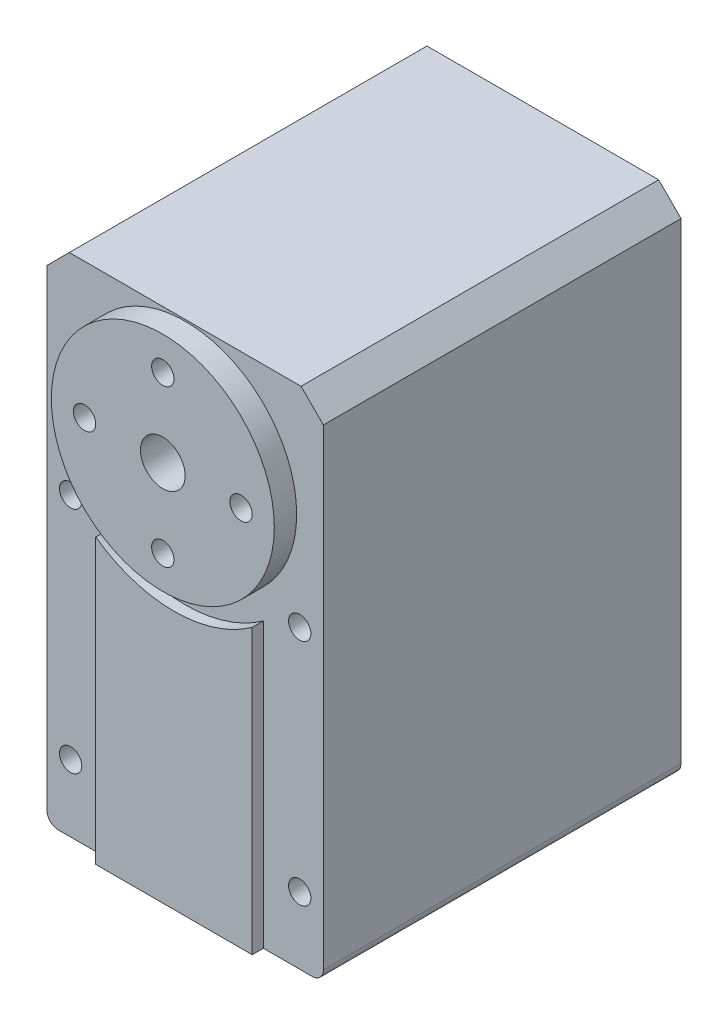
from build123d import *

# Parameters (mm, degrees)
SKETCH_1_W          = 24.73
SKETCH_1_H          = 45.23
EXTRUDE_1_DEPTH     = 32
CHAMFER_1_SIZE      = 2
EXTRUDE_2_DEPTH     = 1
SKETCH_3_R          = 1
CUT_EXTRUDE_1_DEPTH = 4
SKETCH_4_R          = 9.975
EXTRUDE_3_DEPTH     = 2
SKETCH_5_R          = 2
SKETCH_5_R_2        = 1
CUT_EXTRUDE_2_DEPTH = 3
SKETCH_6_W          = 20.33
SKETCH_6_H          = 12
EXTRUDE_4_DEPTH     = 2
CHAMFER_2_SIZE      = 2
SKETCH_7_W          = 22.33
SKETCH_7_H          = 5
CUT_EXTRUDE_3_DEPTH = 2
SKETCH_8_R          = 3
EXTRUDE_5_DEPTH     = 4.1
CUT_EXTRUDE_START   = -4
SKETCH_9_R          = 1
CUT_EXTRUDE_4_DEPTH = 4
FILLET_1_R          = 1


with BuildPart() as part:
    # 스케치1 → 보스-돌출1 (new body)
    with BuildSketch(Plane.XY):
        Rectangle(SKETCH_1_W, SKETCH_1_H)
    extrude(amount=EXTRUDE_1_DEPTH)

    # 모따기1
    chamfer_1_edges = [part.edges().sort_by_distance(p)[0] for p in [
        (-12.365, 22.615, 16),
        (12.365, 22.615, 16),
    ]]
    chamfer(chamfer_1_edges, length=CHAMFER_1_SIZE)

    # 스케치2 → 보스-돌출2 (add)
    with BuildSketch(Plane.XY.offset(32)):
        with BuildLine():
            Line((-7, -22.615), (7, -22.615))
            Line((7, -22.615), (7, 2.753205655))
            ThreePointArc((7, 2.753205655), (0, 0.5), (-7, 2.753205655))
            Line((-7, 2.753205655), (-7, -22.615))
        make_face()
    extrude(amount=EXTRUDE_2_DEPTH)

    # 스케치3 → 컷-돌출1 (cut)
    with BuildSketch(Plane.XY.offset(32)):
        with Locations((-10.25, 3.885)):
            Circle(SKETCH_3_R)
        with Locations((-10.25, -16.615)):
            Circle(SKETCH_3_R)
        with Locations((10.25, -16.615)):
            Circle(SKETCH_3_R)
        with Locations((10.25, 3.885)):
            Circle(SKETCH_3_R)
    extrude(amount=-CUT_EXTRUDE_1_DEPTH, mode=Mode.SUBTRACT)

    # 스케치4 → 보스-돌출3 (add)
    with BuildSketch(Plane.XY.offset(32)):
        with Locations((0, 12.5)):
            Circle(SKETCH_4_R)
    extrude(amount=EXTRUDE_3_DEPTH)

    # 스케치5 → 컷-돌출2 (cut)
    with BuildSketch(Plane.XY.offset(34)):
        with Locations((0, 12.5)):
            Circle(SKETCH_5_R)
        with Locations((0, 19.5)):
            Circle(SKETCH_5_R_2)
        with Locations((7, 12.5)):
            Circle(SKETCH_5_R_2)
        with Locations((0, 5.5)):
            Circle(SKETCH_5_R_2)
        with Locations((-7, 12.5)):
            Circle(SKETCH_5_R_2)
    extrude(amount=-CUT_EXTRUDE_2_DEPTH, mode=Mode.SUBTRACT)

    # 스케치6 → 보스-돌출4 (add)
    with BuildSketch(Plane(origin=(0, 0, 0), x_dir=(-1, 0, 0), z_dir=(0, 0, -1))):
        with Locations((0, -12.115)):
            Rectangle(SKETCH_6_W, SKETCH_6_H)
    extrude(amount=EXTRUDE_4_DEPTH)

    # 모따기2
    chamfer_2_edges = [part.edges().sort_by_distance(p)[0] for p in [
        (0, -6.115, -2),
    ]]
    chamfer(chamfer_2_edges, length=CHAMFER_2_SIZE - 0.0001)  # a hair under: the kernel refuses the full size

    # 스케치7 → 컷-돌출3 (cut)
    with BuildSketch(Plane(origin=(0, 0, 0), x_dir=(-1, 0, 0), z_dir=(0, 0, -1))):
        with Locations((0, -3.615)):
            Rectangle(SKETCH_7_W, SKETCH_7_H)
    extrude(amount=-CUT_EXTRUDE_3_DEPTH, mode=Mode.SUBTRACT)

    # 스케치8 → 보스-돌출5 (add)
    with BuildSketch(Plane(origin=(0, 0, 0), x_dir=(-1, 0, 0), z_dir=(0, 0, -1))):
        with Locations(Location((0, 12.5, 0), (0, 0, 180))):
            Circle(SKETCH_8_R)
    extrude(amount=EXTRUDE_5_DEPTH)

    # 스케치9 → 컷-돌출4 (cut)
    with BuildSketch(Plane(origin=(0, 0, 0), x_dir=(-1, 0, 0), z_dir=(0, 0, -1)).offset(CUT_EXTRUDE_START)):
        with Locations(Location((-10.25, 3.885, 0), (0, 0, 180))):
            Circle(SKETCH_9_R)
        with Locations(Location((10.25, 3.885, 0), (0, 0, 180))):
            Circle(SKETCH_9_R)
        with Locations((-10.25, -20.615)):
            Circle(SKETCH_9_R)
        with Locations((10.25, -20.615)):
            Circle(SKETCH_9_R)
    extrude(amount=CUT_EXTRUDE_4_DEPTH, mode=Mode.SUBTRACT)

    # 필렛1
    fillet_1_edges = [part.edges().sort_by_distance(p)[0] for p in [
        (12.365, -22.615, 16),
        (-12.365, -22.615, 16),
    ]]
    fillet(fillet_1_edges, radius=FILLET_1_R)


solid = part.part
